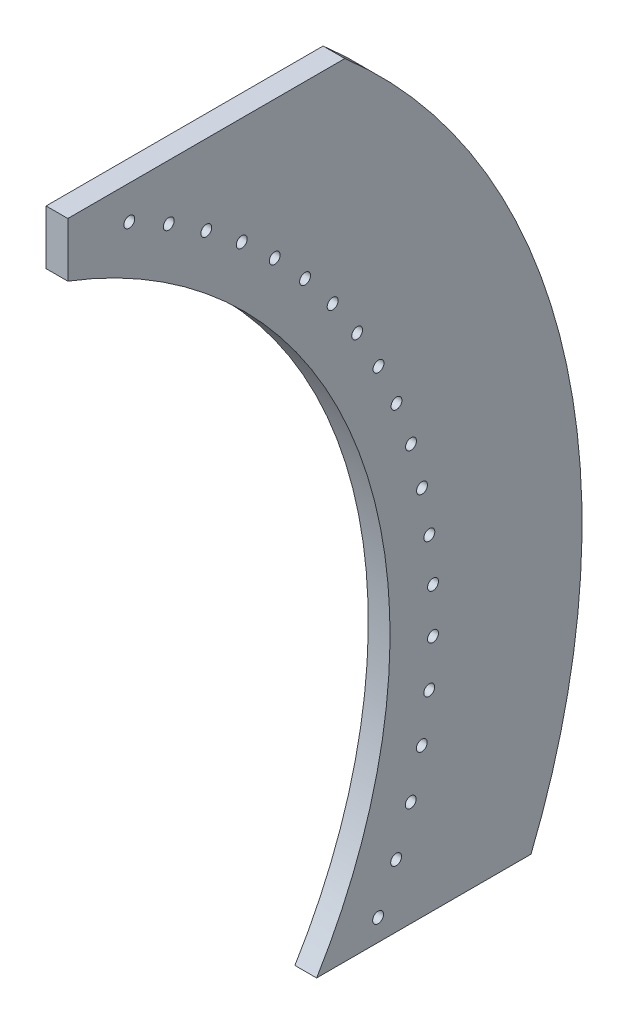
from build123d import *

# Parameters (mm, degrees)
BOSS_EXTRUDE1_DEPTH         = 12.7
SKETCH2_W                   = 852.307145123
SKETCH2_H                   = 152.4
CUT_EXTRUDE1_DEPTH          = 12.7
CUT_EXTRUDE2_DEPTH          = 12.7
F_1_4_0_25_DIAMETER_HOLE1_D = 6.35


with BuildPart() as part:
    # Sketch1 → Boss-Extrude1 (new body)
    with BuildSketch(Plane(origin=(0, 0, 0), x_dir=(0, 0, -1), z_dir=(1, 0, 0))):
        with BuildLine():
            Line((0, 609.6), (323.85, 609.6))
            Line((323.85, 609.6), (323.85, 0))
            Line((323.85, 0), (0, 0))
            Line((0, 0), (0, 31.75))
            ThreePointArc((0, 31.75), (188.340145046, 304.8), (0, 577.85))
            Line((0, 577.85), (0, 609.6))
        make_face()
    extrude(amount=BOSS_EXTRUDE1_DEPTH)

    # Sketch2 → Cut-Extrude1 (cut)
    with BuildSketch(Plane(origin=(12.7, 0, 0), x_dir=(0, 0, -1), z_dir=(1, 0, 0))):
        with Locations((192.653341095, 76.2)):
            Rectangle(SKETCH2_W, SKETCH2_H)
    extrude(amount=-CUT_EXTRUDE1_DEPTH, mode=Mode.SUBTRACT)

    # Sketch3 → Cut-Extrude2 (cut)
    with BuildSketch(Plane(origin=(12.7, 0, 0), x_dir=(0, 0, -1), z_dir=(1, 0, 0))):
        with BuildLine():
            Line((270.760801555, 152.4), (323.85, 152.4))
            Line((323.85, 152.4), (323.85, 609.6))
            Line((323.85, 609.6), (161.925, 609.6))
            ThreePointArc((161.925, 609.6), (289.589524386, 398.436253262), (270.760801555, 152.4))
        make_face()
    extrude(amount=-CUT_EXTRUDE2_DEPTH, mode=Mode.SUBTRACT)

    # 1/4 (0.25) Diameter Hole1 (through all)
    with Locations(Plane(origin=(12.7, 0, 0), x_dir=(0, 0, -1), z_dir=(1, 0, 0))):
        with Locations((181.354437919, 165.1), (191.91696262, 189.121698017), (200.459714845, 213.933596133), (206.924338933, 239.366203925), (211.266674948, 265.245790893), (213.457060331, 291.395573216), (213.480532529, 317.636921367), (211.336931202, 343.790580328), (207.040899322, 369.677894089), (200.621783143, 395.122026048), (192.123431737, 419.949166985), (181.603897461, 443.989722351), (169.1350394, 467.079470776), (154.8020325, 489.060685868), (138.70278573, 509.783213636), (120.94727327, 529.105498206), (101.656783275, 546.89554878), (80.96308935, 563.031841274), (59.00755041, 577.404148448), (35.940145046, 589.914292872)):
            Hole(F_1_4_0_25_DIAMETER_HOLE1_D / 2)


solid = part.part
